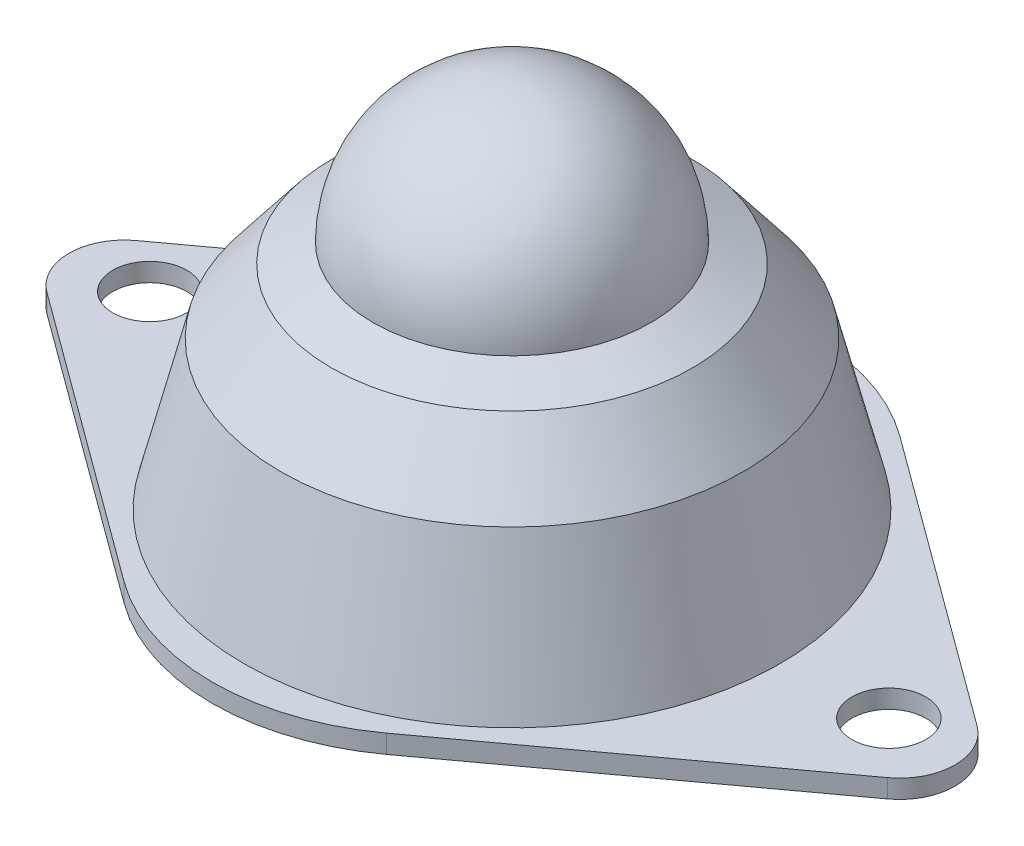
from build123d import *

# Parameters (mm, degrees)
BOSS_EXTRUDE1_DEPTH = 1
FILLET2_R           = 3
FILLET3_R           = 12
SKETCH2_R           = 2
CUT_EXTRUDE1_DEPTH  = 1
SKETCH3_R           = 14.5
BOSS_EXTRUDE2_DEPTH = 8
BOSS_EXTRUDE2_TAPER = 14
SKETCH6_R           = 12.505375977
BOSS_EXTRUDE4_DEPTH = 3.5
BOSS_EXTRUDE4_TAPER = 38
SKETCH7_R           = 9.770876284
BOSS_EXTRUDE5_DEPTH = 1
BOSS_EXTRUDE5_TAPER = 66


# Read off the part's stored shape, not the designer's step: Dome4
with BuildPart() as part:
    # Sketch1 → Boss-Extrude1 (new body)
    with BuildSketch(Plane(origin=(0, 0, 0), x_dir=(1, 0, 0), z_dir=(0, 1, 0))):
        Polygon((-26.05, -2.94e-07), (0, 19.1), (26.05, 2.94e-07), (0, -19.1), align=None)
    extrude(amount=BOSS_EXTRUDE1_DEPTH)

    # Fillet2
    fillet2_edges = [part.edges().sort_by_distance(p)[0] for p in [
        (26.05, 0.5, -2.94e-07),
        (-26.05, 0.5, 2.94e-07),
    ]]
    fillet(fillet2_edges, radius=FILLET2_R)

    # Fillet3
    fillet3_edges = [part.edges().sort_by_distance(p)[0] for p in [
        (0, 0.5, 19.1),
        (0, 0.5, -19.1),
    ]]
    fillet(fillet3_edges, radius=FILLET3_R)

    # Sketch2 → Cut-Extrude1 (cut)
    with BuildSketch(Plane(origin=(0, 1, 0), x_dir=(1, 0, 0), z_dir=(0, 1, 0))):
        with Locations(Location((-19.996075031, 0.396211257, 0), (0, 0, 270))):
            Circle(SKETCH2_R)
        with Locations(Location((19.996075025, 0.39621155, 0), (0, 0, 270))):
            Circle(SKETCH2_R)
    extrude(amount=-CUT_EXTRUDE1_DEPTH, mode=Mode.SUBTRACT)

    # Sketch3 → Boss-Extrude2 (add)
    with BuildSketch(Plane(origin=(0, 1, 0), x_dir=(1, 0, 0), z_dir=(0, 1, 0))):
        Circle(SKETCH3_R)
    extrude(amount=BOSS_EXTRUDE2_DEPTH, taper=BOSS_EXTRUDE2_TAPER)

    # Sketch6 → Boss-Extrude4 (add)
    with BuildSketch(Plane(origin=(0, 9, 0), x_dir=(1, 0, 0), z_dir=(0, 1, 0))):
        Circle(SKETCH6_R)
    extrude(amount=BOSS_EXTRUDE4_DEPTH, taper=BOSS_EXTRUDE4_TAPER)

    # Sketch7 → Boss-Extrude5 (add)
    with BuildSketch(Plane(origin=(0, 12.5, 0), x_dir=(1, 0, 0), z_dir=(0, 1, 0))):
        Circle(SKETCH7_R)
    extrude(amount=BOSS_EXTRUDE5_DEPTH, taper=BOSS_EXTRUDE5_TAPER)

    # Dome4 outline → Dome4 (revolve)
    with BuildSketch(Plane.XY):
        with BuildLine():
            Line((0, 13.5), (7.524839511, 13.499999992))
            ThreePointArc((7.524839511, 13.499999992), (5.312090214, 18.804802861), (0, 21))
            Line((0, 21), (0, 13.5))
        make_face()
    revolve(axis=Axis((0, 0, 0), (0, 1, 0)))


solid = part.part
